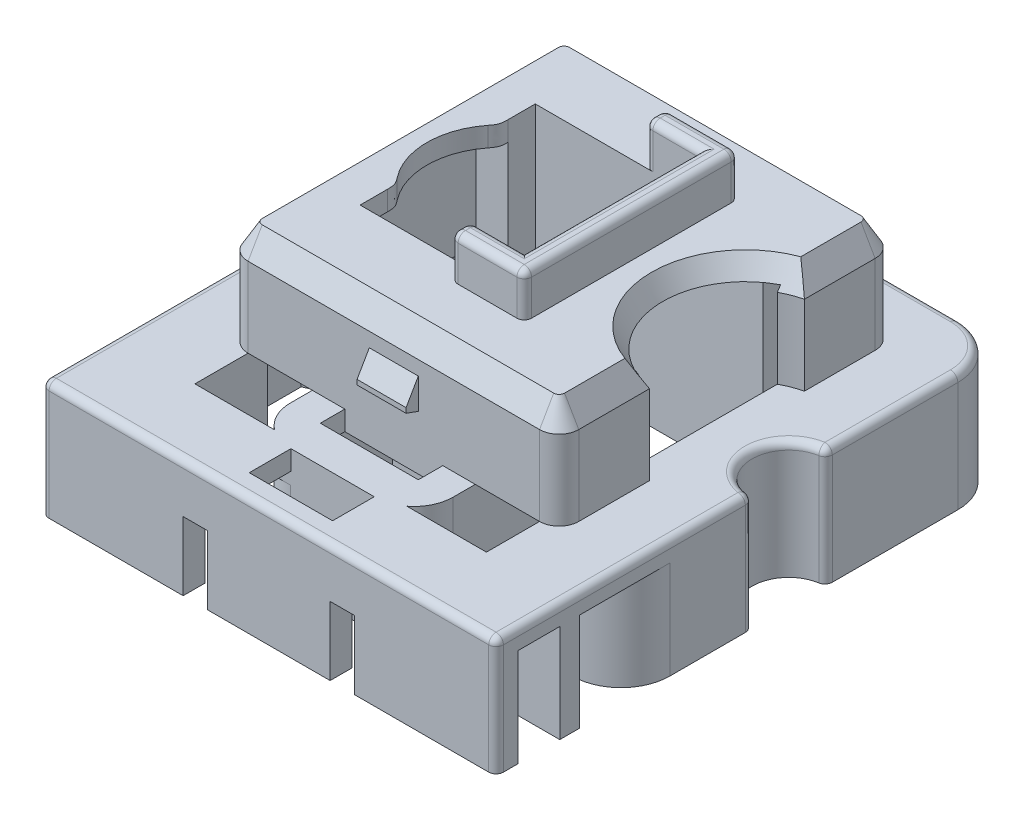
from build123d import *
from OCP.BRepFilletAPI import BRepFilletAPI_MakeChamfer

# Parameters (mm, degrees)
BOSS_EXTRUDE1_DEPTH       = 0.8
BOSS_EXTRUDE2_DEPTH       = 4.25
SKETCH15_W                = 11.9
SKETCH15_H                = 12.1
CUT_EXTRUDE3_DEPTH        = 4.25
SKETCH23_W                = 6.7
SKETCH23_H                = 7.15
CUT_EXTRUDE6_DEPTH        = 0.8
BOSS_EXTRUDE17_DEPTH      = 1.75
SKETCH5_R                 = 3
CUT_EXTRUDE7_DEPTH        = 0.8
SKETCH6_W                 = 2
SKETCH6_H                 = 0.2
BOSS_EXTRUDE4_DEPTH       = 0.5
DRAFT1_ANGLE              = 60
DRAFT4_ANGLE              = 20
SKETCH7_W                 = 4
SKETCH7_H                 = 1
CUT_EXTRUDE1_DEPTH        = 17.273540641
DRAFT1_OF_MIRROR1_2_ANGLE = 60
DRAFT4_OF_MIRROR1_2_ANGLE = 20
SKETCH8_W                 = 18.55
SKETCH8_H                 = 0.9
BOSS_EXTRUDE5_DEPTH       = 4
SKETCH9_W                 = 1
SKETCH9_H                 = 0.9
CUT_EXTRUDE2_DEPTH        = 2.8
BOSS_EXTRUDE6_START       = 4
BOSS_EXTRUDE6_DEPTH       = 4
SKETCH12_W                = 0.8
SKETCH12_H                = 1.7
BOSS_EXTRUDE7_DEPTH       = 1.5
SKETCH13_W                = 16.95
SKETCH13_H                = 0.8
BOSS_EXTRUDE8_DEPTH       = 4
FILLET1_R                 = 1.2
FILLET2_R                 = 2
FILLET3_R                 = 0.3
FILLET5_R                 = 0.8
CHAMFER1_SIZE             = 1
CHAMFER1_SIZE_2           = 0.577350269
BOSS_EXTRUDE9_DEPTH       = 4
BOSS_EXTRUDE10_DEPTH      = 4.25
SKETCH17_W                = 3.4
SKETCH17_H                = 1.7
CUT_EXTRUDE4_DEPTH        = 17.585177871
SKETCH18_W                = 2.8
SKETCH18_H                = 0.2
BOSS_EXTRUDE11_DEPTH      = 0.25
DRAFT2_ANGLE              = 60
DRAFT3_ANGLE              = 20
DRAFT2_OF_MIRROR4_2_ANGLE = 60
DRAFT3_OF_MIRROR4_2_ANGLE = 20
SKETCH19_W                = 9.3
SKETCH19_H                = 5.325
SKETCH19_W_2              = 7.7
SKETCH19_H_2              = 3.725
BOSS_EXTRUDE12_DEPTH      = 4
BOSS_EXTRUDE13_DEPTH      = 4.25
CUT_EXTRUDE5_START        = -0.8
CUT_EXTRUDE5_DEPTH        = 0.8
BOSS_EXTRUDE14_DEPTH      = 0.5
CHAMFER2_SIZE             = 0.5
CHAMFER2_SIZE2            = 0.288675135
SKETCH24_W                = 1.275
SKETCH24_H                = 2.5
BOSS_EXTRUDE15_DEPTH      = 8.25
BOSS_EXTRUDE16_DEPTH      = 8.25


with BuildPart() as part:
    # Sketch1 → Boss-Extrude1 (new body)
    with BuildSketch(Plane(origin=(0, 0, 0), x_dir=(1, 0, 0), z_dir=(0, 1, 0))):
        with BuildLine():
            Line((9.275, -1.5), (9.275, -11.95))
            Line((9.275, -11.95), (-9.275, -11.95))
            Line((-9.275, -11.95), (-9.275, -1.5))
            ThreePointArc((-9.275, -1.5), (-7.775, 0), (-9.275, 1.5))
            Line((-9.275, 1.5), (-9.275, 8.9))
            Line((-9.275, 8.9), (9.275, 8.9))
            Line((9.275, 8.9), (9.275, 1.5))
            ThreePointArc((9.275, 1.5), (7.775, 0), (9.275, -1.5))
        make_face()
    extrude(amount=BOSS_EXTRUDE1_DEPTH)

    # Sketch2 → Boss-Extrude2 (add)
    with BuildSketch(Plane(origin=(0, 0.8, 0), x_dir=(1, 0, 0), z_dir=(0, 1, 0))):
        with BuildLine():
            Line((6.75, -3.16227766), (6.75, -6.85))
            Line((6.75, -6.85), (-6.75, -6.85))
            Line((-6.75, -6.85), (-6.75, 6.85))
            Line((-6.75, 6.85), (6.75, 6.85))
            Line((6.75, 6.85), (6.75, 3.16227766))
            ThreePointArc((6.75, 3.16227766), (4.25, 0), (6.75, -3.16227766))
        make_face()
    extrude(amount=BOSS_EXTRUDE2_DEPTH)

    # Sketch15 → Cut-Extrude3 (cut)
    with BuildSketch(Plane.XZ):
        Rectangle(SKETCH15_W, SKETCH15_H)
    extrude(amount=-CUT_EXTRUDE3_DEPTH, mode=Mode.SUBTRACT)

    # Sketch23 → Cut-Extrude6 (cut)
    with BuildSketch(Plane(origin=(0, 5.05, 0), x_dir=(1, 0, 0), z_dir=(0, 1, 0))):
        with Locations((-1.3, 0)):
            Rectangle(SKETCH23_W, SKETCH23_H)
    extrude(amount=-CUT_EXTRUDE6_DEPTH, mode=Mode.SUBTRACT)

    # Sketch26 → Boss-Extrude17 (add)
    with BuildSketch(Plane(origin=(0, 5.05, -5.05), x_dir=(1, 0, 0), z_dir=(0, -1, 0))):
        Polygon((-0.15, 8.625), (-0.15, 9.425), (2.85, 9.425), (2.85, 0.675), (-0.15, 0.675), (-0.15, 1.475), (2.05, 1.475), (2.05, 8.625), align=None)
    extrude(amount=-BOSS_EXTRUDE17_DEPTH)

    # Sketch5 → Cut-Extrude7 (cut)
    with BuildSketch(Plane(origin=(0, 5.05, 0), x_dir=(1, 0, 0), z_dir=(0, 1, 0))):
        with Locations((-2.5, 0)):
            Circle(SKETCH5_R)
    extrude(amount=-CUT_EXTRUDE7_DEPTH, mode=Mode.SUBTRACT)

    # Sketch6 → Boss-Extrude4 (add)
    with BuildSketch(Plane.XY.offset(6.85)):
        with Locations((0, 2.5)):
            Rectangle(SKETCH6_W, SKETCH6_H)
    boss_extrude4 = extrude(amount=BOSS_EXTRUDE4_DEPTH)

    # Draft1
    draft1_faces = [part.faces().sort_by_distance(p)[0] for p in [
        (0, 2.6, 7.1),
    ]]
    draft(draft1_faces, Plane.XY.offset(7.35), DRAFT1_ANGLE)

    # Draft4
    draft4_faces = [part.faces().sort_by_distance(p)[0] for p in [
        (0, 2.4, 7.1),
    ]]
    draft(draft4_faces, Plane.XY.offset(7.35), DRAFT4_ANGLE)

    # Sketch7 → Cut-Extrude1 (cut, through all)
    with BuildSketch(Plane(origin=(0, 0.8, 0), x_dir=(1, 0, 0), z_dir=(0, 1, 0))):
        with Locations((0, -7.35)):
            Rectangle(SKETCH7_W, SKETCH7_H)
    cut_extrude1 = extrude(amount=-CUT_EXTRUDE1_DEPTH, mode=Mode.SUBTRACT)

    # Mirror1: Boss-Extrude4, Cut-Extrude1 across plane
    add(boss_extrude4.mirror(Plane.XY))
    add(cut_extrude1.mirror(Plane.XY), mode=Mode.SUBTRACT)

    # Draft1 of Mirror1 2
    draft1_of_mirror1_2_faces = [part.faces().sort_by_distance(p)[0] for p in [
        (0, 2.6, -7.1),
    ]]
    draft(draft1_of_mirror1_2_faces, Plane(origin=(0, 0, -7.35), x_dir=(1, 0, 0), z_dir=(0, 0, -1)), DRAFT1_OF_MIRROR1_2_ANGLE)

    # Draft4 of Mirror1 2
    draft4_of_mirror1_2_faces = [part.faces().sort_by_distance(p)[0] for p in [
        (0, 2.4, -7.1),
    ]]
    draft(draft4_of_mirror1_2_faces, Plane(origin=(0, 0, -7.35), x_dir=(1, 0, 0), z_dir=(0, 0, -1)), DRAFT4_OF_MIRROR1_2_ANGLE)

    # Sketch8 → Boss-Extrude5 (add)
    with BuildSketch(Plane(origin=(0, 0, 0), x_dir=(1, 0, 0), z_dir=(0, 1, 0))):
        with Locations((0, -11.5)):
            Rectangle(SKETCH8_W, SKETCH8_H)
    extrude(amount=-BOSS_EXTRUDE5_DEPTH)

    # Sketch9 → Cut-Extrude2 (cut)
    with BuildSketch(Plane(origin=(0, -4, 0), x_dir=(-1, 0, 0), z_dir=(0, -1, 0))):
        with Locations((-3, -11.5)):
            Rectangle(SKETCH9_W, SKETCH9_H)
    cut_extrude2 = extrude(amount=-CUT_EXTRUDE2_DEPTH, mode=Mode.SUBTRACT)

    # Mirror2: Cut-Extrude2 across plane
    add(cut_extrude2.mirror(Plane(origin=(0, 0, 0), x_dir=(0, 0, 1), z_dir=(1, 0, 0))), mode=Mode.SUBTRACT)

    # Sketch11 → Boss-Extrude6 (add)
    with BuildSketch(Plane.XZ.offset(BOSS_EXTRUDE6_START)):
        with BuildLine():
            Line((5.95, 9.35), (9.275, 9.35))
            Line((9.275, 9.35), (9.275, 8.55))
            Line((9.275, 8.55), (6.75, 8.55))
            Line((6.75, 8.55), (6.75, 6.85))
            Line((6.75, 6.85), (7.275, 6.85))
            ThreePointArc((7.275, 6.85), (8.689213562, 6.264213562), (9.275, 4.85))
            Line((9.275, 4.85), (9.275, 1.5))
            ThreePointArc((9.275, 1.5), (7.775, 0), (9.275, -1.5))
            Line((9.275, -1.5), (9.275, -8.9))
            Line((9.275, -8.9), (8.475, -8.9))
            Line((8.475, -8.9), (8.475, -2.156385865))
            ThreePointArc((8.475, -2.156385865), (6.975, 0), (8.475, 2.156385865))
            Line((8.475, 2.156385865), (8.475, 4.85))
            ThreePointArc((8.475, 4.85), (8.123528137, 5.698528137), (7.275, 6.05))
            Line((7.275, 6.05), (5.95, 6.05))
            Line((5.95, 6.05), (5.95, 9.35))
        make_face()
    boss_extrude6 = extrude(amount=-BOSS_EXTRUDE6_DEPTH)

    # Sketch12 → Boss-Extrude7 (add)
    with BuildSketch(Plane.XZ):
        with Locations((6.35, 10.2)):
            Rectangle(SKETCH12_W, SKETCH12_H)
    boss_extrude7 = extrude(amount=BOSS_EXTRUDE7_DEPTH)

    # Mirror3: Boss-Extrude6, Boss-Extrude7 across plane
    add(boss_extrude6.mirror(Plane(origin=(0, 0, 0), x_dir=(0, 0, 1), z_dir=(1, 0, 0))))
    add(boss_extrude7.mirror(Plane(origin=(0, 0, 0), x_dir=(0, 0, 1), z_dir=(1, 0, 0))))

    # Sketch13 → Boss-Extrude8 (add)
    with BuildSketch(Plane.XZ):
        with Locations((0, -8.5)):
            Rectangle(SKETCH13_W, SKETCH13_H)
    extrude(amount=BOSS_EXTRUDE8_DEPTH)

    # Fillet6
    # a fillet whose section is not a circle: 1 mm, written as the material it takes off along each edge
    with BuildSketch(Plane(origin=(-4.65, 3.31747247, -2.092247595), x_dir=(0, 0, -1), z_dir=(0, 1, 0))) as fillet6_piece_1:
        with BuildLine():
            Bezier((0.373011012, 0), (0.028219598, 0), (-0.24330364, 0.2125), weights=[1, 1.857142857, 1])
            ThreePointArc((-0.24330364, 0.2125), (-0.118789521, 0.109527213), (0, 0))
            Line((0, 0), (0.373011012, 0))
        make_face()
    extrude(amount=2.665055059, mode=Mode.SUBTRACT)
    with BuildSketch(Plane(origin=(-4.65, 3.31747247, 2.092247595), x_dir=(-0.6578193581993855, 0, -0.753175737778474), z_dir=(0, 1, 0))) as fillet6_piece_2:
        with BuildLine():
            Bezier((0.323037012, 0), (-0.021254317, 0.018563398), (-0.280942844, 0.245373864), weights=[1, 1.857142857, 1])
            Line((-0.280942844, 0.245373864), (0, 0))
            ThreePointArc((0, 0), (0.161518506, 0.004351193), (0.323037012, 0))
        make_face()
    extrude(amount=2.665055059, mode=Mode.SUBTRACT)

    # Fillet1
    fillet1_edges = [part.edges().sort_by_distance(p)[0] for p in [
        (-8.475, -2, -8.1),
        (8.475, -2, -8.1),
    ]]
    fillet(fillet1_edges, radius=FILLET1_R)

    # Fillet2
    fillet2_edges = [part.edges().sort_by_distance(p)[0] for p in [
        (-9.275, -1.6, -8.9),
        (9.275, -1.6, -8.9),
    ]]
    fillet(fillet2_edges, radius=FILLET2_R)

    # Fillet3
    fillet3_edges = [part.edges().sort_by_distance(p)[0] for p in [
        (7.775, 0.8, 0),
        (9.275, 0.8, -4.2),
        (-9.275, -1.6, 11.95),
        (-9.275, -1.6, 1.5),
        (-9.275, -1.6, -1.5),
        (9.275, -1.6, -1.5),
        (9.275, -1.6, 1.5),
        (9.275, -1.6, 11.95),
        (-7.775, 0.8, 0),
        (-9.275, 0.8, 6.725),
        (0, 0.8, -8.9),
        (-9.275, 0.8, -4.2),
        (-8.689213562, 0.8, -8.314213562),
        (8.689213562, 0.8, -8.314213562),
        (0, 0.8, 11.95),
        (9.275, 0.8, 6.725),
        (0.95, 6.8, 3.575),
        (-0.15, 6.8, 3.975),
        (-0.15, 5.925, 3.575),
        (1.35, 6.8, 4.375),
        (-0.15, 5.925, 4.375),
        (2.85, 6.8, 0),
        (2.85, 5.925, 4.375),
        (1.35, 6.8, -4.375),
        (2.85, 5.925, -4.375),
        (-0.15, 6.8, -3.975),
        (-0.15, 5.925, -4.375),
        (0.95, 6.8, -3.575),
        (-0.15, 5.925, -3.575),
        (2.05, 6.8, 0),
    ]]
    fillet(fillet3_edges, radius=FILLET3_R)

    # Fillet5
    fillet5_edges = [part.edges().sort_by_distance(p)[0] for p in [
        (-6.75, 2.925, 6.85),
        (6.75, 2.925, 6.85),
        (6.75, 2.925, -6.85),
        (-6.75, 2.925, -6.85),
    ]]
    fillet(fillet5_edges, radius=FILLET5_R)

    # Chamfer1
    # the kernel refuses this chamfer: 1, 0.577350269 mm, written as the material it takes off along each edge
    with BuildSketch(Plane(origin=(5.95, 5.05, -6.05), x_dir=(1, 0, 0), z_dir=(0, 0, 1))) as chamfer1_piece_1:
        Polygon((0.8, -CHAMFER1_SIZE), (0.8 - CHAMFER1_SIZE_2, 0), (0.8, 0), align=None)
    revolve(axis=Axis((5.95, 5.05, -6.05), (0, 1, 0)), revolution_arc=90, mode=Mode.SUBTRACT)
    with BuildSketch(Plane(origin=(-5.95, 5.05, -6.85), x_dir=(0, -1, 0), z_dir=(1, 0, 0)), Plane(origin=(5.95, 5.05, 6.85), x_dir=(0, -1, 0), z_dir=(-1, 0, 0))) as chamfer1_piece_2:
        Polygon((CHAMFER1_SIZE, 0), (0, -CHAMFER1_SIZE_2), (0, 0), align=None)
    extrude(amount=11.9, mode=Mode.SUBTRACT)
    with BuildSketch(Plane(origin=(-5.95, 5.05, -6.05), x_dir=(-1, 0, 0), z_dir=(0, 0, 1))) as chamfer1_piece_3:
        Polygon((0.8, CHAMFER1_SIZE), (0.8 - CHAMFER1_SIZE_2, 0), (0.8, 0), align=None)
    revolve(axis=Axis((-5.95, 5.05, -6.05), (0, -1, 0)), revolution_arc=90, mode=Mode.SUBTRACT)
    with BuildSketch(Plane(origin=(-6.75, 5.05, 6.05), x_dir=(0, -1, 0), z_dir=(0, 0, -1))) as chamfer1_piece_4:
        Polygon((CHAMFER1_SIZE, 0), (0, -CHAMFER1_SIZE_2), (0, 0), align=None)
    extrude(amount=12.1, mode=Mode.SUBTRACT)
    with BuildSketch(Plane(origin=(-5.95, 5.05, 6.05), x_dir=(-1, 0, 0), z_dir=(0, 0, -1))) as chamfer1_piece_5:
        Polygon((0.8, -CHAMFER1_SIZE), (0.8 - CHAMFER1_SIZE_2, 0), (0.8, 0), align=None)
    revolve(axis=Axis((-5.95, 5.05, 6.05), (0, 1, 0)), revolution_arc=90, mode=Mode.SUBTRACT)
    with BuildSketch(Plane(origin=(6.75, 5.05, -6.05), x_dir=(0, -1, 0), z_dir=(0, 0, 1)), Plane(origin=(6.75, 5.05, 0.575191906), x_dir=(0, -1, 0), z_dir=(0, 0, 1))) as chamfer1_piece_6:
        Polygon((CHAMFER1_SIZE, 0), (0, -CHAMFER1_SIZE_2), (0, 0), align=None)
    extrude(amount=5.474808094, mode=Mode.SUBTRACT)
    with BuildSketch(Plane(origin=(5.95, 5.05, 6.05), x_dir=(0, 0, 1), z_dir=(-1, 0, 0))) as chamfer1_piece_7:
        Polygon((0.8, -CHAMFER1_SIZE), (0.8 - CHAMFER1_SIZE_2, 0), (0.8, 0), align=None)
    revolve(axis=Axis((5.95, 5.05, 6.05), (0, 1, 0)), revolution_arc=90, mode=Mode.SUBTRACT)
    with BuildSketch(Plane(origin=(7.5, 5.05, 0), x_dir=(0.5346441902469453, 0, -0.8450772685590284), z_dir=(0.8450772685590284, 0, 0.5346441902469453))) as chamfer1_piece_8:
        Polygon((3.25, -CHAMFER1_SIZE), (3.25 + CHAMFER1_SIZE_2, 0), (3.25, 0), align=None)
    revolve(axis=Axis((7.5, 5.05, 0), (0, 1, 0)), revolution_arc=244.639568982, mode=Mode.SUBTRACT)

    # Sketch14 → Boss-Extrude9 (add)
    with BuildSketch(Plane.XZ):
        with BuildLine():
            Line((-1.725, 9.35), (1.725, 9.35))
            ThreePointArc((1.725, 9.35), (2.85637085, 8.88137085), (3.325, 7.75))
            Line((3.325, 7.75), (3.325, 3.575))
            Line((3.325, 3.575), (-3.325, 3.575))
            Line((-3.325, 3.575), (-3.325, 7.75))
            ThreePointArc((-3.325, 7.75), (-2.85637085, 8.88137085), (-1.725, 9.35))
        make_face()
        with BuildLine():
            Line((-1.725, 8.55), (1.725, 8.55))
            ThreePointArc((1.725, 8.55), (2.290685425, 8.315685425), (2.525, 7.75))
            Line((2.525, 7.75), (2.525, 4.375))
            Line((2.525, 4.375), (-2.525, 4.375))
            Line((-2.525, 4.375), (-2.525, 7.75))
            ThreePointArc((-2.525, 7.75), (-2.290685425, 8.315685425), (-1.725, 8.55))
        make_face(mode=Mode.SUBTRACT)
    extrude(amount=BOSS_EXTRUDE9_DEPTH)

    # Sketch16 → Boss-Extrude10 (add)
    with BuildSketch(Plane.XZ):
        Polygon((-3.325, 6.05), (-3.325, 3.575), (3.325, 3.575), (3.325, 6.05), (2.525, 6.05), (2.525, 4.375), (-2.525, 4.375), (-2.525, 6.05), align=None)
    extrude(amount=-BOSS_EXTRUDE10_DEPTH)

    # Sketch17 → Cut-Extrude4 (cut, through all)
    with BuildSketch(Plane.XZ):
        with Locations((0, 10.2)):
            Rectangle(SKETCH17_W, SKETCH17_H)
    extrude(amount=-CUT_EXTRUDE4_DEPTH, mode=Mode.SUBTRACT)

    # Sketch18 → Boss-Extrude11 (add)
    with BuildSketch(Plane(origin=(0, 0, 11.05), x_dir=(-1, 0, 0), z_dir=(0, 0, -1))):
        with Locations((0, -3.2)):
            Rectangle(SKETCH18_W, SKETCH18_H)
    boss_extrude11 = extrude(amount=BOSS_EXTRUDE11_DEPTH)

    # Draft2
    draft2_faces = [part.faces().sort_by_distance(p)[0] for p in [
        (0, -3.3, 10.925),
    ]]
    draft(draft2_faces, Plane(origin=(0, 0, 10.8), x_dir=(-1, 0, 0), z_dir=(0, 0, -1)), DRAFT2_ANGLE)

    # Draft3
    draft3_faces = [part.faces().sort_by_distance(p)[0] for p in [
        (0, -3.1, 10.925),
    ]]
    draft(draft3_faces, Plane(origin=(0, 0, 10.8), x_dir=(-1, 0, 0), z_dir=(0, 0, -1)), DRAFT3_ANGLE)

    # Mirror4: Boss-Extrude11 across plane
    add(boss_extrude11.mirror(Plane(origin=(0, 0, 10.2), x_dir=(1, 0, 0), z_dir=(0, 0, -1))))

    # Draft2 of Mirror4 2
    draft2_of_mirror4_2_faces = [part.faces().sort_by_distance(p)[0] for p in [
        (0, -3.3, 9.475),
    ]]
    draft(draft2_of_mirror4_2_faces, Plane(origin=(0, 0, 9.6), x_dir=(-1, 0, 0), z_dir=(0, 0, 1)), DRAFT2_OF_MIRROR4_2_ANGLE)

    # Draft3 of Mirror4 2
    draft3_of_mirror4_2_faces = [part.faces().sort_by_distance(p)[0] for p in [
        (0, -3.1, 9.475),
    ]]
    draft(draft3_of_mirror4_2_faces, Plane(origin=(0, 0, 9.6), x_dir=(-1, 0, 0), z_dir=(0, 0, 1)), DRAFT3_OF_MIRROR4_2_ANGLE)

    # Sketch19 → Boss-Extrude12 (add)
    with BuildSketch(Plane.XZ):
        with Locations((0, -6.2375)):
            Rectangle(SKETCH19_W, SKETCH19_H)
        with Locations((0, -6.2375)):
            Rectangle(SKETCH19_W_2, SKETCH19_H_2, mode=Mode.SUBTRACT)
    extrude(amount=BOSS_EXTRUDE12_DEPTH)

    # Sketch20 → Boss-Extrude13 (add)
    with BuildSketch(Plane.XZ):
        Polygon((4.65, -6.05), (4.65, -3.575), (-4.65, -3.575), (-4.65, -6.05), (-3.85, -6.05), (-3.85, -4.375), (3.85, -4.375), (3.85, -6.05), align=None)
    extrude(amount=-BOSS_EXTRUDE13_DEPTH)

    # Sketch21 → Cut-Extrude5 (cut)
    with BuildSketch(Plane.XZ.offset(CUT_EXTRUDE5_START)):
        with BuildLine():
            Line((2.7, 9.018611446), (5.95, 9.018611446))
            Line((5.95, 9.018611446), (5.95, 6.05))
            Line((5.95, 6.05), (3.325, 6.05))
            Line((3.325, 6.05), (3.325, 7.75))
            ThreePointArc((3.325, 7.75), (3.160270009, 8.457106781), (2.7, 9.018611446))
        make_face()
    cut_extrude5 = extrude(amount=CUT_EXTRUDE5_DEPTH, mode=Mode.SUBTRACT)

    # Sketch22 → Boss-Extrude14 (add)
    with BuildSketch(Plane.XZ):
        with BuildLine():
            Line((1.725, 9.35), (5.95, 9.35))
            Line((5.95, 9.35), (5.95, 9.018611446))
            Line((5.95, 9.018611446), (2.7, 9.018611446))
            ThreePointArc((2.7, 9.018611446), (2.239889157, 9.264889157), (1.725, 9.35))
        make_face()
    boss_extrude14 = extrude(amount=BOSS_EXTRUDE14_DEPTH)

    # Mirror5: Cut-Extrude5, Boss-Extrude14 across plane
    add(cut_extrude5.mirror(Plane(origin=(0, 0, 0), x_dir=(0, 0, 1), z_dir=(1, 0, 0))), mode=Mode.SUBTRACT)
    add(boss_extrude14.mirror(Plane(origin=(0, 0, 0), x_dir=(0, 0, 1), z_dir=(1, 0, 0))))

    # Chamfer2: one chamfer whose edges measure the first distance from different faces: ONE call of the kernel's chamfer builder (chamfer() names one face for all edges)
    chamfer2_edges_1 = [part.edges().sort_by_distance(p)[0] for p in [
        (4.6375, 0.8, 6.05),
    ]]
    chamfer2_side_1 = [part.faces().sort_by_distance(p)[0] for p in [
        (4.6375, 2.525, 6.05),
    ]]
    chamfer2_edges_2 = [part.edges().sort_by_distance(p)[0] for p in [
        (-4.6375, 0.8, 6.05),
    ]]
    chamfer2_side_2 = [part.faces().sort_by_distance(p)[0] for p in [
        (-4.6375, 0.8, 6.45),
    ]]
    chamfer2 = BRepFilletAPI_MakeChamfer(part.part.solid().wrapped)
    for e in chamfer2_edges_1:
        chamfer2.Add(CHAMFER2_SIZE, CHAMFER2_SIZE2, e.wrapped, chamfer2_side_1[0].wrapped)  # the first distance lies on this face
    for e in chamfer2_edges_2:
        chamfer2.Add(CHAMFER2_SIZE, CHAMFER2_SIZE2, e.wrapped, chamfer2_side_2[0].wrapped)  # the first distance lies on this face
    add(Compound.cast(chamfer2.Shape()), mode=Mode.REPLACE)

    # Sketch24 → Boss-Extrude15 (add)
    with BuildSketch(Plane.XZ.offset(-4.25)):
        with Locations((2.6875, 2.325)):
            Rectangle(SKETCH24_W, SKETCH24_H)
    extrude(amount=BOSS_EXTRUDE15_DEPTH)

    # Sketch25 → Boss-Extrude16 (add)
    with BuildSketch(Plane.XZ.offset(-4.25)):
        Polygon((-4.65, -2.465258607), (-5.95, -2.465258607), (-5.95, -6.05), (-4.65, -6.05), (-4.65, -3.575), align=None)
    extrude(amount=BOSS_EXTRUDE16_DEPTH)


solid = part.part
